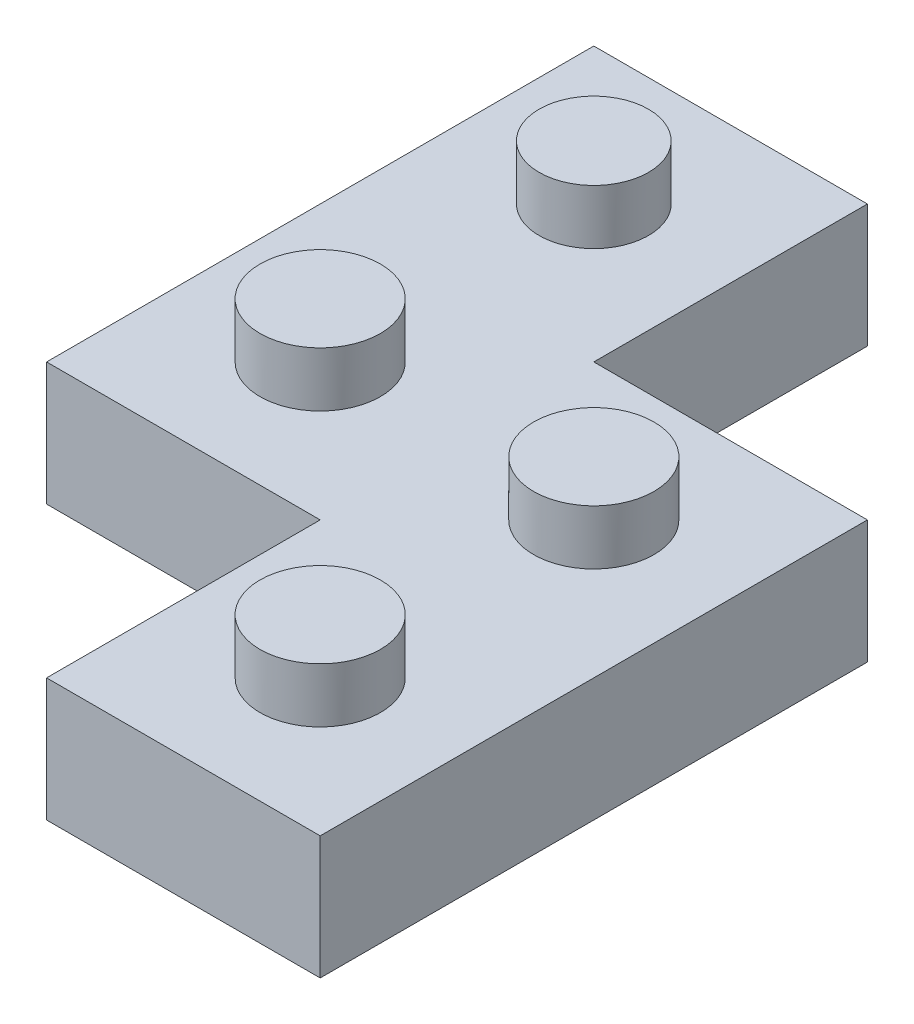
from build123d import *

# Parameters (mm, degrees)
BOSS_EXTRUDE1_DEPTH = 5.715
SKETCH2_R           = 2.794
SKETCH2_R_2         = 2.54
BOSS_EXTRUDE3_DEPTH = 2.54


with BuildPart() as part:
    # Sketch1 → Boss-Extrude1 (new body)
    with BuildSketch(Plane(origin=(0, 0, 0), x_dir=(1, 0, 0), z_dir=(0, 1, 0))):
        Polygon((-5.674598366, 20.311212687), (7.025401634, 20.311212687), (7.025401634, 7.611212687), (19.725401634, 7.611212687), (19.725401634, -17.788787313), (7.025401634, -17.788787313), (7.025401634, -5.088787313), (-5.674598366, -5.088787313), align=None)
    extrude(amount=BOSS_EXTRUDE1_DEPTH)

    # Sketch2 → Boss-Extrude3 (add)
    with BuildSketch(Plane(origin=(0, 5.715, 0), x_dir=(1, 0, 0), z_dir=(0, 1, 0))):
        with Locations((0.675401634, 1.261212687)):
            Circle(SKETCH2_R)
        with Locations((13.375401634, 1.261212687)):
            Circle(SKETCH2_R)
        with Locations((0.675401634, 13.961212687)):
            Circle(SKETCH2_R_2)
        with Locations((13.375401634, -11.438787313)):
            Circle(SKETCH2_R)
    extrude(amount=BOSS_EXTRUDE3_DEPTH)


solid = part.part
